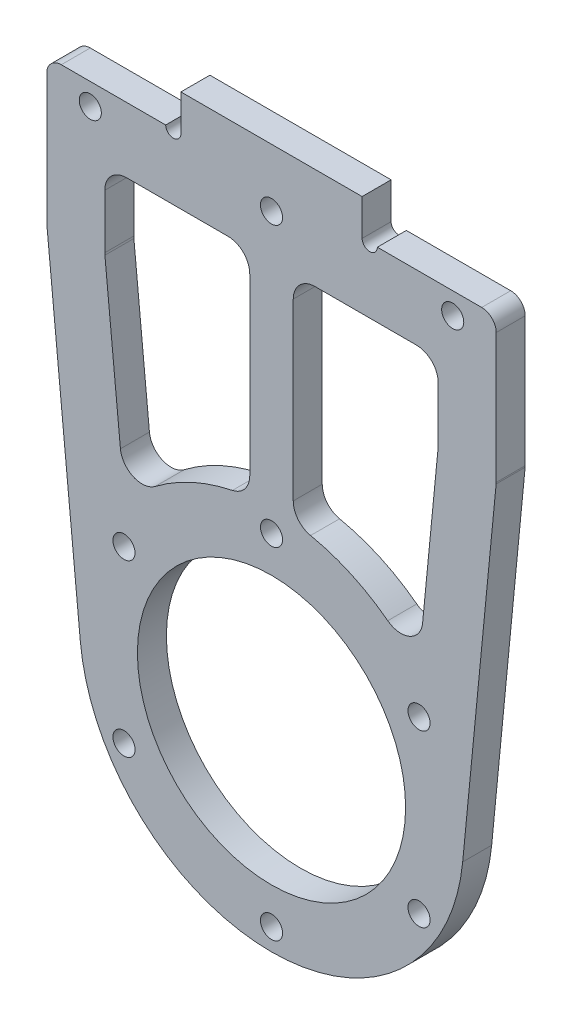
from build123d import *

# Parameters (mm, degrees)
SKETCH_1_R          = 18.5
EXTRUDE_1_DEPTH     = 4
CUT_EXTRUDE_1_DEPTH = 10
SKETCH_3_R          = 1.525
CUT_EXTRUDE_2_DEPTH = 22
SKETCH_4_R          = 1.525
CUT_EXTRUDE_3_DEPTH = 22
FILLET_1_R          = 2
SKETCH_5_W          = 25
SKETCH_5_H          = 5
EXTRUDE_2_DEPTH     = 4
SKETCH_6_R          = 1.05
CUT_EXTRUDE_4_DEPTH = 4
CUT_EXTRUDE_5_DEPTH = 52
FILLET_3_R          = 3


with BuildPart() as part:
    # 草图1 → 凸台-拉伸1 (new body)
    with BuildSketch(Plane.XY):
        with BuildLine():
            Line((-31, 0), (-31, 65))
            Line((-31, 65), (31, 65))
            Line((31, 65), (31, 0))
            ThreePointArc((31, 0), (0, -31), (-31, 0))
        make_face()
        Circle(SKETCH_1_R, mode=Mode.SUBTRACT)
    extrude(amount=EXTRUDE_1_DEPTH)

    # 草图2 → 切除-拉伸1 (cut)
    with BuildSketch(Plane.XY.offset(4)):
        with BuildLine():
            Line((-26.375636933, -2.564327665), (-31, 45))
            Line((-31, 45), (-31, -32))
            Line((-31, -32), (31, -32))
            Line((31, -32), (31, 45))
            Line((31, 45), (26.375636933, -2.564327665))
            ThreePointArc((26.375636933, -2.564327665), (0, -26.5), (-26.375636933, -2.564327665))
        make_face()
    extrude(amount=-CUT_EXTRUDE_1_DEPTH, mode=Mode.SUBTRACT)

    # 草图3 → 切除-拉伸2 (cut)
    with BuildSketch(Plane.XY.offset(4)):
        with Locations((0, 23.5)):
            Circle(SKETCH_3_R)
        with Locations((20.351596989, 11.75)):
            Circle(SKETCH_3_R)
        with Locations((20.351596989, -11.75)):
            Circle(SKETCH_3_R)
        with Locations((0, -23.5)):
            Circle(SKETCH_3_R)
        with Locations((-20.351596989, -11.75)):
            Circle(SKETCH_3_R)
        with Locations((-20.351596989, 11.75)):
            Circle(SKETCH_3_R)
    extrude(amount=-CUT_EXTRUDE_2_DEPTH, mode=Mode.SUBTRACT)

    # 草图4 → 切除-拉伸3 (cut)
    with BuildSketch(Plane.XY.offset(4)):
        with Locations((25, 62)):
            Circle(SKETCH_4_R)
        with Locations((0, 62)):
            Circle(SKETCH_4_R)
        with Locations((-25, 62)):
            Circle(SKETCH_4_R)
    extrude(amount=-CUT_EXTRUDE_3_DEPTH, mode=Mode.SUBTRACT)

    # 圆角1
    # the kernel refuses this fillet: 2 mm, written as the material it takes off along each edge
    with BuildSketch(Plane(origin=(-31, 45, 4.242486693), x_dir=(0, 1, 0), z_dir=(0, 0, -1)), Plane(origin=(31, 45, 4.242486693), x_dir=(-0.09676708169889991, -0.9953070540790306, 0), z_dir=(0, 0, -1))) as fillet_1_piece_1:
        with BuildLine():
            CenterArc((FILLET_1_R * 0.048497338543, FILLET_1_R), FILLET_1_R, 264.446965205, 5.553034795)
            Line((-FILLET_1_R * 0.0482697431559, FILLET_1_R * 0.00469294592097), (0, 0))
            Line((0, 0), (FILLET_1_R * 0.048497338543, 0))
        make_face()
    extrude(amount=4.484973385, mode=Mode.SUBTRACT)
    with BuildSketch(Plane(origin=(-31, 65, -5), x_dir=(0, -1, 0), z_dir=(0, 0, 1)), Plane(origin=(31, 65, -5), x_dir=(-1, 0, 0), z_dir=(0, 0, 1))) as fillet_1_piece_2:
        with BuildLine():
            CenterArc((FILLET_1_R, FILLET_1_R), FILLET_1_R, 180, 90)
            Line((0, FILLET_1_R), (0, 0))
            Line((0, 0), (FILLET_1_R, 0))
        make_face()
    extrude(amount=14, mode=Mode.SUBTRACT)

    # 草图5 → 凸台-拉伸2 (add)
    with BuildSketch(Plane.XY.offset(4)):
        with Locations((0, 67.5)):
            Rectangle(SKETCH_5_W, SKETCH_5_H)
    extrude(amount=-EXTRUDE_2_DEPTH)

    # 草图6 → 切除-拉伸4 (cut)
    with BuildSketch(Plane(origin=(0, 0, 0), x_dir=(-1, 0, 0), z_dir=(0, 0, -1))):
        with Locations((13.55, 65)):
            Circle(SKETCH_6_R)
        with Locations((-13.55, 65)):
            Circle(SKETCH_6_R)
    extrude(amount=-CUT_EXTRUDE_4_DEPTH, mode=Mode.SUBTRACT)

    # 草图7 → 切除-拉伸5 (cut)
    with BuildSketch(Plane.XY.offset(4)):
        with BuildLine():
            Line((-3, 26.329641091), (-3, 56))
            Line((-3, 56), (-23, 56))
            Line((-23, 56), (-23, 45.387978708))
            Line((-23, 45.387978708), (-20.249206785, 17.094432561))
            ThreePointArc((-20.249206785, 17.094432561), (-12.508144274, 23.362284281), (-3, 26.329641091))
        make_face()
        with BuildLine():
            Line((3, 56), (3, 26.329641091))
            ThreePointArc((3, 26.329641091), (12.508144274, 23.362284281), (20.249206785, 17.094432561))
            Line((20.249206785, 17.094432561), (23, 45.387978708))
            Line((23, 45.387978708), (23, 56))
            Line((23, 56), (3, 56))
        make_face()
    extrude(amount=-CUT_EXTRUDE_5_DEPTH, mode=Mode.SUBTRACT)

    # 圆角3
    # the kernel refuses this fillet: 3 mm, written as the material it adds along each edge
    with BuildSketch(Plane(origin=(-3, 26.329641091, 4), x_dir=(0, 1, 0), z_dir=(0, 0, -1))) as fillet_3_piece_1:
        with BuildLine():
            CenterArc((2.553745137, -3), FILLET_3_R, 90, 78.264742526)
            ThreePointArc((-0.383548378, -2.389830508), (-0.164475151, -1.199296528), (0, 0))
            Line((0, 0), (2.553745137, 0))
        make_face()
    extrude(amount=4)
    with BuildSketch(Plane(origin=(-20.249206785, 17.094432561, 4), x_dir=(0.7249016624604615, 0.6888523642712269, 0), z_dir=(0, 0, -1))) as fillet_3_piece_2:
        with BuildLine():
            CenterArc((6.134944493, -2.981943006), FILLET_3_R, 96.289524431, 121.69677285)
            Line((3.770470579, -4.828362003), (0, 0))
            ThreePointArc((0, 0), (2.903143376, -0.159503449), (5.806286752, 0))
        make_face()
    extrude(amount=4)
    with BuildSketch(Plane(origin=(-23, 45.387978708, 4), x_dir=(0.09676708169889287, -0.9953070540790314, 0), z_dir=(0, 0, -1)), Plane(origin=(23, 45.387978708, 4), x_dir=(0, 1, 0), z_dir=(0, 0, -1))) as fillet_3_piece_3:
        with BuildLine():
            CenterArc((FILLET_3_R * 0.048497338543, -FILLET_3_R), FILLET_3_R, 90, 5.553034795)
            Line((-FILLET_3_R * 0.0482697431559, -FILLET_3_R * 0.00469294592097), (0, 0))
            Line((0, 0), (FILLET_3_R * 0.048497338543, 0))
        make_face()
    extrude(amount=4)
    with BuildSketch(Plane(origin=(-23, 56, 4), x_dir=(0, -1, 0), z_dir=(0, 0, -1)), Plane(origin=(3, 56, 4), x_dir=(0, -1, 0), z_dir=(0, 0, -1)), Plane(origin=(23, 56, 4), x_dir=(-1, 0, 0), z_dir=(0, 0, -1))) as fillet_3_piece_4:
        with BuildLine():
            CenterArc((FILLET_3_R, -FILLET_3_R), FILLET_3_R, 90, 90)
            Line((0, -FILLET_3_R), (0, 0))
            Line((0, 0), (FILLET_3_R, 0))
        make_face()
    extrude(amount=4)
    with BuildSketch(Plane(origin=(-3, 56, 4), x_dir=(0, -1, 0), z_dir=(0, 0, -1))) as fillet_3_piece_5:
        with BuildLine():
            CenterArc((FILLET_3_R, FILLET_3_R), FILLET_3_R, 180, 90)
            Line((0, FILLET_3_R), (0, 0))
            Line((0, 0), (FILLET_3_R, 0))
        make_face()
    extrude(amount=4)
    with BuildSketch(Plane(origin=(20.249206785, 17.094432561, 4), x_dir=(0.09676708169888887, 0.9953070540790317, 0), z_dir=(0, 0, -1))) as fillet_3_piece_6:
        with BuildLine():
            CenterArc((6.126134835, -3), FILLET_3_R, 90, 121.69677285)
            ThreePointArc((3.57361272, -4.576271186), (1.912520275, -2.189965527), (0, 0))
            Line((0, 0), (6.126134835, 0))
        make_face()
    extrude(amount=4)
    with BuildSketch(Plane(origin=(3, 26.329641091, 4), x_dir=(0, 1, 0), z_dir=(0, 0, -1))) as fillet_3_piece_7:
        with BuildLine():
            CenterArc((2.553745137, 3), FILLET_3_R, 191.735257474, 78.264742526)
            ThreePointArc((-0.383548378, 2.389830508), (-0.164475151, 1.199296528), (0, 0))
            Line((0, 0), (2.553745137, 0))
        make_face()
    extrude(amount=4)


solid = part.part
